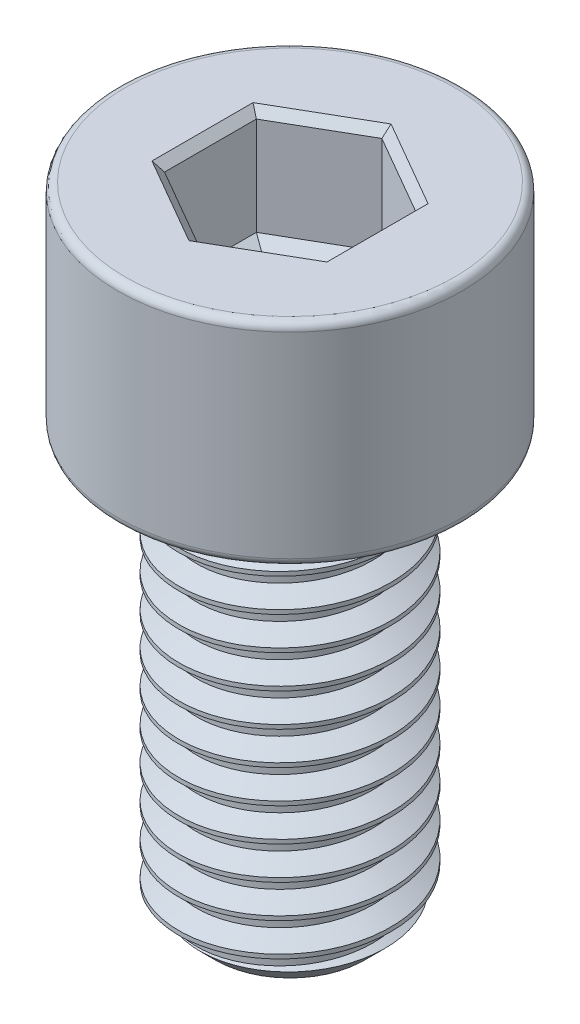
from build123d import *

# Parameters (mm, degrees)
SKETCH1_R           = 4
BOSS_EXTRUDE1_DEPTH = 16
THREAD1_PITCH       = 1.25
SKETCH2_R           = 6.5
BOSS_EXTRUDE2_DEPTH = 8
FILLET1_R           = 0.3
CUT_EXTRUDE1_DEPTH  = 4
CHAMFER1_SIZE       = 0.3
CUT_EXTRUDE2_DEPTH  = 0.4
CUT_EXTRUDE2_DRAFT  = -60


with BuildPart() as part:
    # Sketch1 → Boss-Extrude1 (new body)
    with BuildSketch(Plane(origin=(0, 0, 0), x_dir=(1, 0, 0), z_dir=(0, 1, 0))):
        with Locations(Location((0, 0, 0), (0, 0, 270))):
            Circle(SKETCH1_R)
    extrude(amount=BOSS_EXTRUDE1_DEPTH)

    # Thread1: the profile of Thread Profile1 profile screwed along a right-hand helix of 13.8 turns, 8 arcs to a turn; built about Z, then put on its axis
    thread1_z = Axis((0, 0, 0), (0, 0, 1))
    thread1_corners = [(4.0003, 0, -0.000173205), (4.0003, 0, 1.093923202), (3.323417656, 0, 0.703124998), (3.323417656, 0, 0.390624998)]
    with BuildLine(mode=Mode.PRIVATE) as thread1_profile:
        Line(thread1_corners[0], thread1_corners[1])
        Line(thread1_corners[1], thread1_corners[2])
        Line(thread1_corners[2], thread1_corners[3])
        Line(thread1_corners[3], thread1_corners[0])
    thread1_cap = Face(thread1_profile.wire())
    thread1_turn_angles = [0, 22.5, 45, 67.5, 90, 112.5, 135, 157.5, 180, 202.5, 225, 247.5, 270, 292.5, 315, 337.5, 360]
    thread1_turn_weights = [1, 0.9238795325112867, 1, 0.9238795325112867, 1, 0.9238795325112867, 1, 0.9238795325112867, 1, 0.9238795325112867, 1, 0.9238795325112867, 1, 0.9238795325112867, 1, 0.9238795325112867, 1]
    thread1_turn_rails = [Edge.make_bspline([Vector(p[0], p[1], 0).rotate(thread1_z, thread1_turn_angles[k]) / thread1_turn_weights[k] + Vector(0, 0, p[2] + THREAD1_PITCH * thread1_turn_angles[k] / 360) for k in range(17)], [0, 0, 0, 1, 1, 2, 2, 3, 3, 4, 4, 5, 5, 6, 6, 7, 7, 8, 8, 8], 2, thread1_turn_weights) for p in thread1_corners]
    thread1_turn_sides = [Face.make_surface_from_curves(thread1_turn_rails[p[0]], thread1_turn_rails[p[1]]) for p in [(0, 1), (1, 2), (2, 3), (3, 0)]]
    thread1_last_angles = [4680, 4702.5, 4725, 4747.5, 4770, 4792.5, 4815, 4837.5, 4860, 4882.5, 4905, 4927.5, 4950, 4959, 4968]
    thread1_last_weights = [1, 0.9238795325112867, 1, 0.9238795325112867, 1, 0.9238795325112867, 1, 0.9238795325112867, 1, 0.9238795325112867, 1, 0.9238795325112867, 1, 0.9876883405951378, 1]
    thread1_last_rails = [Edge.make_bspline([Vector(p[0], p[1], 0).rotate(thread1_z, thread1_last_angles[k]) / thread1_last_weights[k] + Vector(0, 0, p[2] + THREAD1_PITCH * thread1_last_angles[k] / 360) for k in range(15)], [0, 0, 0, 1, 1, 2, 2, 3, 3, 4, 4, 5, 5, 6, 6, 7, 7, 7], 2, thread1_last_weights) for p in thread1_corners]
    thread1_last_sides = [Face.make_surface_from_curves(thread1_last_rails[p[0]], thread1_last_rails[p[1]]) for p in [(0, 1), (1, 2), (2, 3), (3, 0)]]
    thread1 = Plane(origin=(0, 17.25, 0), x_dir=(-1, 0, 0), z_dir=(0, -1, 0)) * Solid(Shell([*[p.moved(Location((0, 0, THREAD1_PITCH * i))) for i in range(13) for p in thread1_turn_sides], *thread1_last_sides, thread1_cap, thread1_cap.rotate(thread1_z, 4968).moved(Location((0, 0, THREAD1_PITCH * 4968 / 360)))]))
    add(thread1, mode=Mode.SUBTRACT)

    # Sketch2 → Boss-Extrude2 (add)
    with BuildSketch(Plane(origin=(0, 16, 0), x_dir=(1, 0, 0), z_dir=(0, 1, 0))):
        with Locations(Location((0, 0, 0), (0, 0, 270))):
            Circle(SKETCH2_R)
    extrude(amount=BOSS_EXTRUDE2_DEPTH)

    # Sketch5 → Cut-Revolve1 (revolve, cut)
    with BuildSketch(Plane.XY, mode=Mode.PRIVATE) as cut_revolve1_sk:
        Polygon((4.01, 0), (4.01, 1.2), (2.81, 0), align=None)
    revolve(cut_revolve1_sk.sketch.rotate(Axis((0, 0, 0), (0, 1, 0)), 242.488882913), axis=Axis((0, 0, 0), (0, 1, 0)), mode=Mode.SUBTRACT)

    # Fillet1
    fillet1_edges = [part.edges().sort_by_distance(p)[0] for p in [
        (0, 16, -6.5),
        (0, 24, -6.5),
    ]]
    fillet(fillet1_edges, radius=FILLET1_R)

    # Sketch6 → Cut-Extrude1 (cut)
    with BuildSketch(Plane(origin=(0, 24, 0), x_dir=(1, 0, 0), z_dir=(0, 1, 0))):
        Polygon((0, 3.464101615), (-3, 1.732050808), (-3, -1.732050808), (0, -3.464101615), (3, -1.732050808), (3, 1.732050808), align=None)
    extrude(amount=-CUT_EXTRUDE1_DEPTH, mode=Mode.SUBTRACT)

    # Chamfer1
    chamfer1_edges = [part.edges().sort_by_distance(p)[0] for p in [
        (1.5, 24, -2.598076211),
        (-1.5, 24, -2.598076211),
        (-3, 24, 0),
        (-1.5, 24, 2.598076211),
        (1.5, 24, 2.598076211),
        (3, 24, 0),
    ]]
    chamfer(chamfer1_edges, length=CHAMFER1_SIZE)


with BuildPart() as cut_extrude2_tool:
    # Sketch7 → Cut-Extrude2 (with draft: the straight prism first)
    with BuildSketch(Plane(origin=(0, 20, 0), x_dir=(1, 0, 0), z_dir=(0, 1, 0))):
        Polygon((0, 3.464101615), (-3, 1.732050808), (-3, -1.732050808), (0, -3.464101615), (3, -1.732050808), (3, 1.732050808), align=None)
    extrude(amount=-CUT_EXTRUDE2_DEPTH)
    # Cut-Extrude2: the draft: its side faces are tilted about the plane it starts from
    cut_extrude2_sides = [cut_extrude2_tool.faces().sort_by_distance(p)[0] for p in [
        (-1.5, 19.8, -2.598076211),
        (-3, 19.8, 0),
        (-1.5, 19.8, 2.598076211),
        (1.5, 19.8, 2.598076211),
        (3, 19.8, 0),
        (1.5, 19.8, -2.598076211),
    ]]
    draft(cut_extrude2_sides, Plane(origin=(0, 20, 0), x_dir=(1, 0, 0), z_dir=(0, 1, 0)), CUT_EXTRUDE2_DRAFT)


with BuildPart() as part_1:
    add(part.part)

    # Cut-Extrude2: cut by cut_extrude2_tool
    add(cut_extrude2_tool.part, mode=Mode.SUBTRACT)


solid = part_1.part
